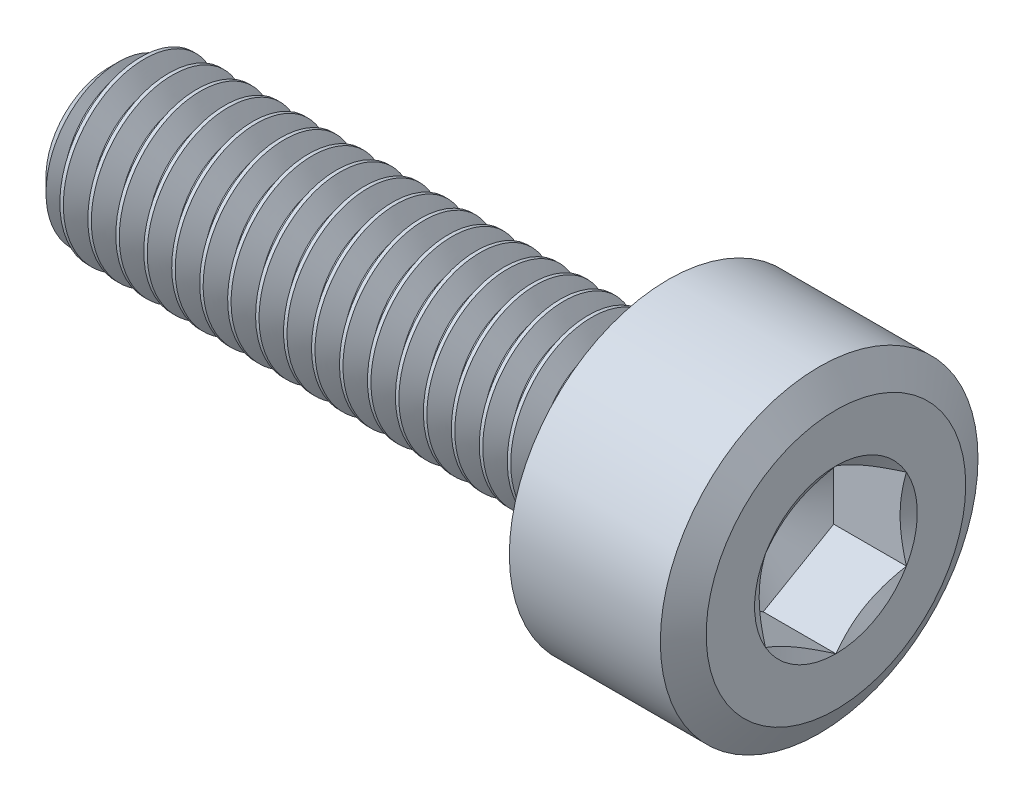
from build123d import *

# Parameters (mm, degrees)
CUT_EXTRUDE1_DEPTH = 1.3
SKETCH7_R          = 1.454922678
CUT_EXTRUDE3_DEPTH = 0.55
CUT_EXTRUDE3_DRAFT = -60
CUT_SWEEP1_PITCH   = 0.5
CUT_SWEEP1_TO      = 9.7


with BuildPart() as part:
    # Sketch2 → Revolve1 (revolve)
    with BuildSketch(Plane.XY, mode=Mode.PRIVATE) as revolve1_sk:
        with BuildLine():
            Line((-6.5, 1.125), (-6.5, 0))
            Line((-6.5, 0), (5.2, 0))
            Line((5.2, 0), (5.2, 1.26))
            Line((5.2, 1.26), (6.5, 1.26))
            Line((6.5, 1.26), (6.5, 2.320384758))
            Line((6.5, 2.320384758), (6.2, 2.84))
            Line((6.2, 2.84), (3.5, 2.84))
            Line((3.5, 2.84), (3.5, 1.8))
            ThreePointArc((3.5, 1.8), (3.412132034, 1.587867966), (3.2, 1.5))
            Line((3.2, 1.5), (-6.125, 1.5))
            Line((-6.125, 1.5), (-6.5, 1.125))
        make_face()
    revolve(revolve1_sk.sketch.rotate(Axis((6.5, 0, 0), (-1, 0, 0)), 90), axis=Axis((6.5, 0, 0), (-1, 0, 0)))

    # Sketch3 → Cut-Extrude1 (cut)
    with BuildSketch(Plane(origin=(6.5, 0, 0), x_dir=(0, 0, -1), z_dir=(1, 0, 0))):
        Polygon((0, 1.454922678), (-1.26, 0.727461339), (-1.26, -0.727461339), (0, -1.454922678), (1.26, -0.727461339), (1.26, 0.727461339), align=None)
    extrude(amount=-CUT_EXTRUDE1_DEPTH, mode=Mode.SUBTRACT)

    # Cut-Extrude2 cone 1 section (through the dimple's axis) → Cut-Extrude2 (revolve, cut)
    with BuildSketch(Plane(origin=(6.5, 0, 0), x_dir=(0, 0, -1), z_dir=(0, 1, 0))):
        Polygon((0, 0), (1.454922678, 0), (0, 0.84), align=None)
    revolve(axis=Axis((6.5, 0, 0), (-1, 0, 0)), mode=Mode.SUBTRACT)


with BuildPart() as cut_extrude3_tool:
    # Sketch7 → Cut-Extrude3 (with draft: the straight prism first)
    with BuildSketch(Plane(origin=(5.2, 0, 0), x_dir=(0, 0, -1), z_dir=(1, 0, 0))):
        Circle(SKETCH7_R)
    extrude(amount=-CUT_EXTRUDE3_DEPTH)
    # Cut-Extrude3: the draft: its side faces are tilted about the plane it starts from
    cut_extrude3_sides = [cut_extrude3_tool.faces().sort_by_distance(p)[0] for p in [
        (4.925, 0, 1.454922678),
    ]]
    draft(cut_extrude3_sides, Plane(origin=(5.2, 0, 0), x_dir=(0, 0, -1), z_dir=(1, 0, 0)), CUT_EXTRUDE3_DRAFT)


with BuildPart() as part_1:
    add(part.part)

    # Cut-Extrude3: cut by cut_extrude3_tool
    add(cut_extrude3_tool.part, mode=Mode.SUBTRACT)


with BuildPart() as body_2:
    # Split1: the piece on the far side of the plane
    add(part_1.part)
    split(bisect_by=Plane(origin=(3.2, 0, 0), x_dir=(0, 0, 1), z_dir=(1, 0, 0)), keep=Keep.BOTTOM)

    # Cut-Sweep1: arcs per turn and ends read off the stored shape
    # Cut-Sweep1: the profile of Sketch5 screwed along a right-hand helix through 21 turns, 6 arcs to a turn; built about Z, then put on its axis
    cut_sweep1_z = Axis((0, 0, 0), (0, 0, 1))
    cut_sweep1_corners = [(1.527063294, 0, -0.453125), (1.527063294, 0, 0.015625), (1.175240474, 0, -0.1875), (1.175240474, 0, -0.25)]
    with BuildLine(mode=Mode.PRIVATE) as cut_sweep1_profile:
        Line(cut_sweep1_corners[0], cut_sweep1_corners[1])
        Line(cut_sweep1_corners[1], cut_sweep1_corners[2])
        Line(cut_sweep1_corners[2], cut_sweep1_corners[3])
        Line(cut_sweep1_corners[3], cut_sweep1_corners[0])
    cut_sweep1_cap = Face(cut_sweep1_profile.wire())
    cut_sweep1_turn_angles = [0, 30, 60, 90, 120, 150, 180, 210, 240, 270, 300, 330, 360]
    cut_sweep1_turn_weights = [1, 0.8660254037844387, 1, 0.8660254037844387, 1, 0.8660254037844387, 1, 0.8660254037844387, 1, 0.8660254037844387, 1, 0.8660254037844387, 1]
    cut_sweep1_turn_rails = [Edge.make_bspline([Vector(p[0], p[1], 0).rotate(cut_sweep1_z, cut_sweep1_turn_angles[k]) / cut_sweep1_turn_weights[k] + Vector(0, 0, p[2] + CUT_SWEEP1_PITCH * cut_sweep1_turn_angles[k] / 360) for k in range(13)], [0, 0, 0, 1, 1, 2, 2, 3, 3, 4, 4, 5, 5, 6, 6, 6], 2, cut_sweep1_turn_weights) for p in cut_sweep1_corners]
    cut_sweep1_turn_sides = [Face.make_surface_from_curves(cut_sweep1_turn_rails[p[0]], cut_sweep1_turn_rails[p[1]]) for p in [(0, 1), (1, 2), (2, 3), (3, 0)]]
    cut_sweep1 = Plane(origin=(-6.5, 0, 0), x_dir=(0, 1, 0), z_dir=(1, 0, 0)) * split(Solid(Shell([*[p.moved(Location((0, 0, CUT_SWEEP1_PITCH * i))) for i in range(21) for p in cut_sweep1_turn_sides], cut_sweep1_cap, cut_sweep1_cap.rotate(cut_sweep1_z, 7560).moved(Location((0, 0, CUT_SWEEP1_PITCH * 7560 / 360)))])), bisect_by=Plane.XY.offset(CUT_SWEEP1_TO), keep=Keep.BOTTOM, mode=Mode.PRIVATE)
    add(cut_sweep1, mode=Mode.SUBTRACT)


with BuildPart() as part_2:
    add(part_1.part)

    # Split1
    split(bisect_by=Plane(origin=(3.2, 0, 0), x_dir=(0, 0, 1), z_dir=(1, 0, 0)), keep=Keep.TOP)


with BuildPart() as body_2_1:
    add(body_2.part)

    # Combine1: union part
    add(part_2.part)


solid = body_2_1.part
